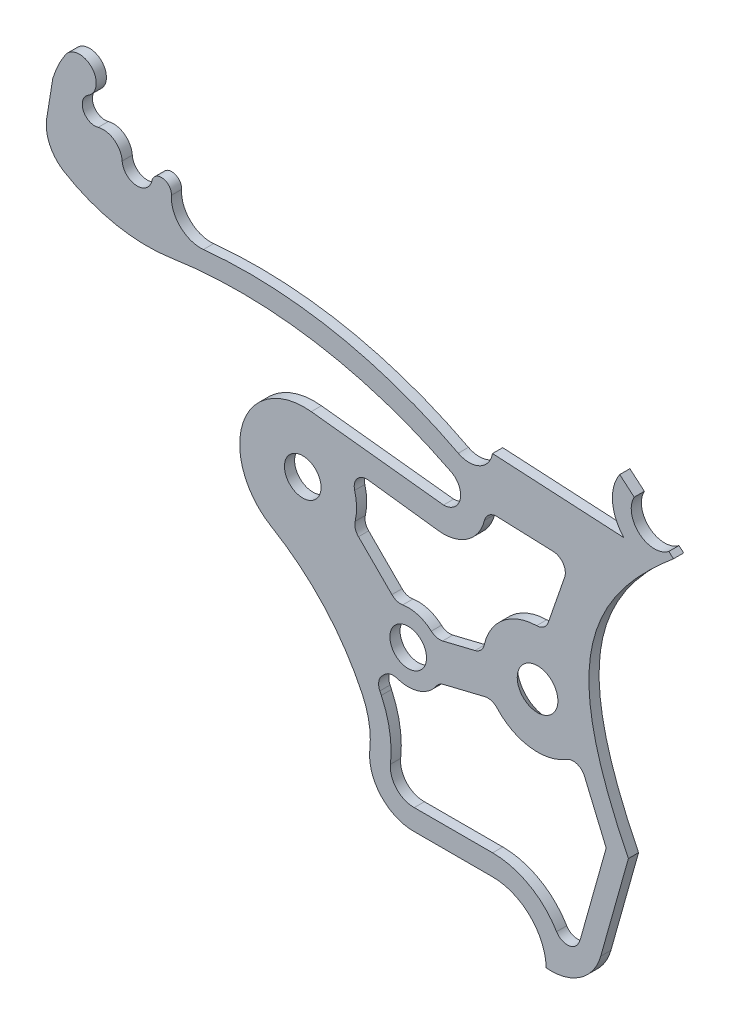
from build123d import *

# Parameters (mm, degrees)
SCALE1_START       = 1.378692074
SCALE1_OUTLINE_R   = 0.4392
SCALE1_DEPTH       = 0.244
CUT_EXTRUDE1_DEPTH = 2.54
CUT_EXTRUDE2_DEPTH = 51.110559093
CUT_EXTRUDE3_DEPTH = 51.110559093
CUT_EXTRUDE4_DEPTH = 51.110559093


with BuildPart() as part:
    # Scale1: read off the stored shape, not the designer's step
    # Scale1 outline → Scale1 (new body)
    with BuildSketch(Plane.XY.offset(SCALE1_START)):
        with BuildLine():
            Line((17.68301566, 43.704577473), (17.346177673, 41.830755017))
            ThreePointArc((17.346177673, 41.830755017), (17.037161165, 41.420736581), (16.523766226, 41.426389643))
            ThreePointArc((16.523766226, 41.426389643), (13.552700425, 42.459086685), (10.410542545, 42.602401154))
            ThreePointArc((10.410542545, 42.602401154), (9.854263516, 42.795493333), (9.640942513, 43.344333108))
            ThreePointArc((9.640942513, 43.344333108), (9.437328912, 43.59391361), (9.172716599, 43.410258363))
            ThreePointArc((9.172716599, 43.410258363), (8.792265037, 43.128007225), (8.459444481, 43.465111917))
            ThreePointArc((8.459444481, 43.465111917), (8.269075619, 43.807602921), (7.883340454, 43.876514268))
            ThreePointArc((7.883340454, 43.876514268), (7.526718951, 44.047734987), (7.645582772, 44.425050271))
            ThreePointArc((7.645582772, 44.425050271), (7.724200076, 45.050111764), (7.096911805, 44.991871103))
            ThreePointArc((7.096911805, 44.991871103), (6.923054486, 44.682724324), (6.79514349, 44.351911876))
            Line((6.79514349, 44.351911876), (6.650098626, 43.450480425))
            ThreePointArc((6.650098626, 43.450480425), (6.721898103, 42.933324679), (7.071222107, 42.545280904))
            ThreePointArc((7.071222107, 42.545280904), (8.30836308, 42.068484056), (9.633857836, 42.038207468))
            ThreePointArc((9.633857836, 42.038207468), (13.079663737, 42.019930147), (16.355693709, 40.951501394))
            ThreePointArc((16.355693709, 40.951501394), (16.569606698, 40.488798349), (16.169670974, 40.172721944))
            Line((16.169670974, 40.172721944), (12.996206362, 40.526319917))
            ThreePointArc((12.996206362, 40.526319917), (11.358592721, 39.478912268), (12.040129402, 37.658376915))
            ThreePointArc((12.040129402, 37.658376915), (13.31395276, 36.623381651), (14.225764982, 35.258669367))
            ThreePointArc((14.225764982, 35.258669367), (14.386229966, 34.744015637), (14.401396414, 34.205139535))
            ThreePointArc((14.401396414, 34.205139535), (14.672806749, 33.376647317), (15.474699865, 33.034550319))
            Line((15.474699865, 33.034550319), (17.348101609, 33.034550317))
            ThreePointArc((17.348101609, 33.034550317), (18.244587572, 32.671085647), (18.634843629, 31.785933762))
            ThreePointArc((18.634843629, 31.785933762), (19.451177789, 31.997778319), (19.942322167, 32.683385187))
            Line((19.942322167, 32.683385187), (21.269314636, 37.404760613))
            ThreePointArc((21.269314636, 37.404760613), (21.73439895, 38.387008616), (22.497682404, 39.16064479))
            Line((22.497682404, 39.16064479), (23.128103851, 39.765569271))
            ThreePointArc((23.128103851, 39.765569271), (23.52490002, 40.486669007), (23.253920075, 41.263844598))
            Line((23.253920075, 41.263844598), (22.452558823, 42.115876451))
            ThreePointArc((22.452558823, 42.115876451), (22.115289154, 42.23834678), (21.816559174, 42.039575025))
            Line((21.816559174, 42.039575025), (21.688661164, 41.814089241))
            Line((21.688661164, 41.814089241), (21.575749212, 41.910847183))
            ThreePointArc((21.575749212, 41.910847183), (20.868513286, 41.926668482), (20.744543825, 42.623134233))
            Line((20.744543825, 42.623134233), (18.940412338, 44.169153428))
            ThreePointArc((18.940412338, 44.169153428), (18.175234277, 44.306254238), (17.68301566, 43.704577473))
        make_face()
        with Locations((15.322718522, 36.789890957)):
            Circle(SCALE1_OUTLINE_R, mode=Mode.SUBTRACT)
        with Locations((12.792357561, 39.068616569)):
            Circle(SCALE1_OUTLINE_R, mode=Mode.SUBTRACT)
    extrude(amount=SCALE1_DEPTH)

    # Scale1 2 outline → Scale1 2 (revolve, cut)
    with BuildSketch(Plane(origin=(18.426504279, 37.473794578, 0), x_dir=(1, 0, 0), z_dir=(0, -1, 0))):
        Polygon((0, 1.378692074), (0.732, 1.378692074), (0.488, 1.622692074), (0, 1.622692074), align=None)
    revolve(axis=Axis((18.426504279, 37.473794578, 0), (0, 0, 1)), mode=Mode.SUBTRACT)

    # Sketch1 → Cut-Extrude1 (cut)
    with BuildSketch(Plane(origin=(0, 0, 1.378692074), x_dir=(-1, 0, 0), z_dir=(0, 0, -1))):
        with BuildLine():
            Line((-21.688661166, 41.81408924), (-21.982980789, 42.999564373))
            Line((-21.982980789, 42.999564373), (-25.421126936, 39.405059446))
            Line((-25.421126936, 39.405059446), (-20.605818398, 35.044072901))
            add(Edge.make_bspline(
                [(-21.688661166, 41.81408924), (-19.489266143, 39.961862231), (-18.997440369, 38.289314262), (-20.605818398, 35.044072901)],
                knots=[0, 0, 0, 0, 1, 1, 1, 1], degree=3))
        make_face()
    extrude(amount=-CUT_EXTRUDE1_DEPTH, mode=Mode.SUBTRACT)

    # Sketch2 → Cut-Extrude2 (cut, through all)
    with BuildSketch(Plane(origin=(0, 0, 1.378692074), x_dir=(-1, 0, 0), z_dir=(0, 0, -1))):
        with BuildLine():
            Line((-17.348101609, 33.534550318), (-15.46825055, 33.534550318))
            ThreePointArc((-15.46825055, 33.534550318), (-15.042927497, 33.712833322), (-14.89843377, 34.150790045))
            ThreePointArc((-14.89843377, 34.150790045), (-14.879423654, 34.826234772), (-14.678291655, 35.471318396))
            ThreePointArc((-14.678291655, 35.471318396), (-14.660582055, 35.508670476), (-14.642615597, 35.545899689))
            ThreePointArc((-14.642615597, 35.545899689), (-14.616480362, 35.726837837), (-14.700216201, 35.889349293))
            Line((-14.700216201, 35.889349293), (-14.751462797, 35.940595889))
            ThreePointArc((-14.751462797, 35.940595889), (-14.895326012, 36.020592881), (-15.059742801, 36.012639096))
            ThreePointArc((-15.059742801, 36.012639096), (-15.580994431, 36.011064763), (-15.998016925, 36.323791449))
            ThreePointArc((-15.998016925, 36.323791449), (-16.074795707, 36.400479379), (-16.173833875, 36.44483545))
            Line((-16.173833875, 36.44483545), (-17.161803556, 36.685788167))
            ThreePointArc((-17.161803556, 36.685788167), (-17.321020312, 36.681092865), (-17.455391032, 36.595556142))
            ThreePointArc((-17.455391032, 36.595556142), (-18.245306435, 36.177055965), (-19.119682785, 36.362998806))
            ThreePointArc((-19.119682785, 36.362998806), (-19.377471249, 36.391695847), (-19.561279678, 36.208685263))
            Line((-19.561279678, 36.208685263), (-20.072904791, 34.995897621))
            Line((-20.072904791, 34.995897621), (-19.460972938, 32.818673477))
            ThreePointArc((-19.460972938, 32.818673477), (-19.437288786, 32.748237282), (-19.40663946, 32.680540786))
            ThreePointArc((-19.40663946, 32.680540786), (-19.149382906, 32.518029269), (-18.882393628, 32.66400068))
            ThreePointArc((-18.882393628, 32.66400068), (-18.230131749, 33.301751954), (-17.348101609, 33.534550318))
        make_face()
    extrude(amount=-CUT_EXTRUDE2_DEPTH, mode=Mode.SUBTRACT)

    # Sketch3 → Cut-Extrude3 (cut, through all)
    with BuildSketch(Plane(origin=(0, 0, 1.378692074), x_dir=(-1, 0, 0), z_dir=(0, 0, -1))):
        with BuildLine():
            Line((-20.496817758, 41.658030449), (-17.346177676, 41.830755017))
            Line((-17.346177676, 41.830755017), (-17.346177676, 45.415633963))
            Line((-17.346177676, 45.415633963), (-20.923893138, 43.312384261))
            ThreePointArc((-20.923893138, 43.312384261), (-20.253979171, 42.603021979), (-20.496817758, 41.658030449))
        make_face()
    extrude(amount=-CUT_EXTRUDE3_DEPTH, mode=Mode.SUBTRACT)

    # Sketch4 → Cut-Extrude4 (cut, through all)
    with BuildSketch(Plane(origin=(0, 0, 1.378692074), x_dir=(-1, 0, 0), z_dir=(0, 0, -1))):
        with BuildLine():
            Line((-17.455852383, 40.574313146), (-18.8042073, 40.524397539))
            ThreePointArc((-18.8042073, 40.524397539), (-19.040601602, 40.394153532), (-19.076676041, 40.126675679))
            Line((-19.076676041, 40.126675679), (-18.682397479, 38.984966524))
            ThreePointArc((-18.682397479, 38.984966524), (-18.575024983, 38.840086232), (-18.403989188, 38.782938099))
            ThreePointArc((-18.403989188, 38.782938099), (-17.597035683, 38.48688171), (-17.14755053, 37.754224599))
            ThreePointArc((-17.14755053, 37.754224599), (-17.069108072, 37.608838613), (-16.925594615, 37.527020573))
            Line((-16.925594615, 37.527020573), (-16.148609211, 37.337524127))
            ThreePointArc((-16.148609211, 37.337524127), (-16.00427201, 37.33806247), (-15.876892057, 37.405943726))
            ThreePointArc((-15.876892057, 37.405943726), (-15.557022892, 37.584705893), (-15.191334883, 37.60803988))
            ThreePointArc((-15.191334883, 37.60803988), (-15.051369663, 37.618828593), (-14.931636329, 37.692112887))
            Line((-14.931636329, 37.692112887), (-14.130011628, 38.493737588))
            ThreePointArc((-14.130011628, 38.493737588), (-14.053640182, 38.623615493), (-14.050038507, 38.774240511))
            ThreePointArc((-14.050038507, 38.774240511), (-14.083791972, 39.093431642), (-14.037801355, 39.411090481))
            ThreePointArc((-14.037801355, 39.411090481), (-14.100156714, 39.686879536), (-14.364076124, 39.788340557))
            Line((-14.364076124, 39.788340557), (-16.044195491, 39.579464149))
            ThreePointArc((-16.044195491, 39.579464149), (-16.744622059, 39.75112655), (-17.15323559, 40.345349015))
            ThreePointArc((-17.15323559, 40.345349015), (-17.263742997, 40.513756841), (-17.455852383, 40.574313146))
        make_face()
    extrude(amount=-CUT_EXTRUDE4_DEPTH, mode=Mode.SUBTRACT)


solid = part.part
